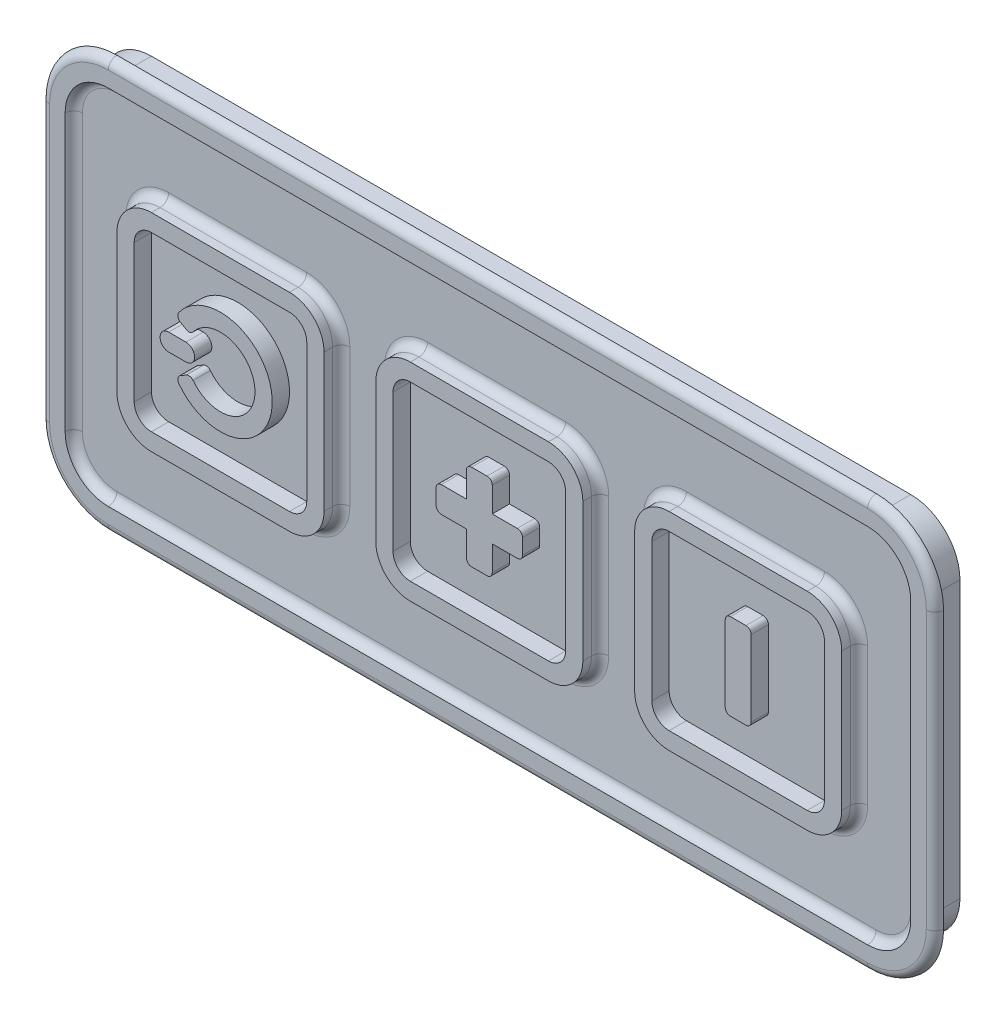
from build123d import *

# Parameters (mm, degrees)
EXTRUDE_1_DEPTH     = 2
EXTRUDE_2_DEPTH     = 0.5
CUT_EXTRUDE_1_DEPTH = 1
EXTRUDE_3_DEPTH     = 1
FILLET_3_R          = 0.5
EXTRUDE_4_DEPTH     = 1
CUT_EXTRUDE_2_DEPTH = 2
FILLET_5_R          = 0.5
EXTRUDE_START       = 1
EXTRUDE_5_DEPTH     = 1
FILLET_6_R          = 0.5


with BuildPart() as part:
    # 草图1 → 凸台-拉伸1 (new body)
    with BuildSketch(Plane.XY):
        with BuildLine():
            Line((26.455957239, 8), (26.455957239, -8))
            ThreePointArc((26.455957239, -8), (27.305347574, -10.050609665), (29.355957239, -10.9))
            Line((29.355957239, -10.9), (73.355957239, -10.9))
            ThreePointArc((73.355957239, -10.9), (75.406566904, -10.050609665), (76.255957239, -8))
            Line((76.255957239, -8), (76.255957239, 8))
            ThreePointArc((76.255957239, 8), (75.406566904, 10.050609665), (73.355957239, 10.9))
            Line((73.355957239, 10.9), (29.355957239, 10.9))
            ThreePointArc((29.355957239, 10.9), (27.305347574, 10.050609665), (26.455957239, 8))
        make_face()
    extrude(amount=-EXTRUDE_1_DEPTH)

    # 草图2 → 凸台-拉伸2 (add)
    with BuildSketch(Plane.XY):
        with BuildLine():
            Line((25.455957239, 8), (25.455957239, -8))
            ThreePointArc((25.455957239, -8), (26.598240792, -10.757716447), (29.355957239, -11.9))
            Line((29.355957239, -11.9), (73.355957239, -11.9))
            ThreePointArc((73.355957239, -11.9), (76.113673686, -10.757716447), (77.255957239, -8))
            Line((77.255957239, -8), (77.255957239, 8))
            ThreePointArc((77.255957239, 8), (76.113673686, 10.757716447), (73.355957239, 11.9))
            Line((73.355957239, 11.9), (29.355957239, 11.9))
            ThreePointArc((29.355957239, 11.9), (26.598240792, 10.757716447), (25.455957239, 8))
        make_face()
        with BuildLine():
            Line((26.855957239, 8), (26.855957239, -8))
            ThreePointArc((26.855957239, -8), (27.588190286, -9.767766953), (29.355957239, -10.5))
            Line((29.355957239, -10.5), (73.355957239, -10.5))
            ThreePointArc((73.355957239, -10.5), (75.123724192, -9.767766953), (75.855957239, -8))
            Line((75.855957239, -8), (75.855957239, 8))
            ThreePointArc((75.855957239, 8), (75.123724192, 9.767766953), (73.355957239, 10.5))
            Line((73.355957239, 10.5), (29.355957239, 10.5))
            ThreePointArc((29.355957239, 10.5), (27.588190286, 9.767766953), (26.855957239, 8))
        make_face(mode=Mode.SUBTRACT)
    extrude(amount=EXTRUDE_2_DEPTH)

    # 草图3 → 切除-拉伸1 (cut)
    with BuildSketch(Plane(origin=(0, 0, -2), x_dir=(-1, 0, 0), z_dir=(0, 0, -1))):
        with BuildLine():
            Line((-29.355957239, 9.9), (-73.355957239, 9.9))
            ThreePointArc((-73.355957239, 9.9), (-74.699460123, 9.343502884), (-75.255957239, 8))
            Line((-75.255957239, 8), (-75.255957239, -8))
            ThreePointArc((-75.255957239, -8), (-74.699460123, -9.343502884), (-73.355957239, -9.9))
            Line((-73.355957239, -9.9), (-29.355957239, -9.9))
            ThreePointArc((-29.355957239, -9.9), (-28.012454355, -9.343502884), (-27.455957239, -8))
            Line((-27.455957239, -8), (-27.455957239, 8))
            ThreePointArc((-27.455957239, 8), (-28.012454355, 9.343502884), (-29.355957239, 9.9))
        make_face()
    extrude(amount=-CUT_EXTRUDE_1_DEPTH, mode=Mode.SUBTRACT)

    # 草图4 → 凸台-拉伸3 (add)
    # profile 1 of 3: a face of its own
    with BuildSketch(Plane.XY):
        with BuildLine():
            Line((32.355957239, 6), (40.355957239, 6))
            ThreePointArc((40.355957239, 6), (41.770170801, 5.414213562), (42.355957239, 4))
            Line((42.355957239, 4), (42.355957239, -4))
            ThreePointArc((42.355957239, -4), (41.770170801, -5.414213562), (40.355957239, -6))
            Line((40.355957239, -6), (32.355957239, -6))
            ThreePointArc((32.355957239, -6), (30.941743677, -5.414213562), (30.355957239, -4))
            Line((30.355957239, -4), (30.355957239, 4))
            ThreePointArc((30.355957239, 4), (30.941743677, 5.414213562), (32.355957239, 6))
        make_face()
        with BuildLine():
            Line((32.355957239, 5), (40.355957239, 5))
            ThreePointArc((40.355957239, 5), (41.06306402, 4.707106781), (41.355957239, 4))
            Line((41.355957239, 4), (41.355957239, -4))
            ThreePointArc((41.355957239, -4), (41.06306402, -4.707106781), (40.355957239, -5))
            Line((40.355957239, -5), (32.355957239, -5))
            ThreePointArc((32.355957239, -5), (31.648850458, -4.707106781), (31.355957239, -4))
            Line((31.355957239, -4), (31.355957239, 4))
            ThreePointArc((31.355957239, 4), (31.648850458, 4.707106781), (32.355957239, 5))
        make_face(mode=Mode.SUBTRACT)
    # profile 2 of 3: a face of its own
    with BuildSketch(Plane.XY):
        with BuildLine():
            Line((47.355957239, 6), (55.355957239, 6))
            ThreePointArc((55.355957239, 6), (56.770170801, 5.414213562), (57.355957239, 4))
            Line((57.355957239, 4), (57.355957239, -4))
            ThreePointArc((57.355957239, -4), (56.770170801, -5.414213562), (55.355957239, -6))
            Line((55.355957239, -6), (47.355957239, -6))
            ThreePointArc((47.355957239, -6), (45.941743677, -5.414213562), (45.355957239, -4))
            Line((45.355957239, -4), (45.355957239, 4))
            ThreePointArc((45.355957239, 4), (45.941743677, 5.414213562), (47.355957239, 6))
        make_face()
        with BuildLine():
            Line((47.355957239, 5), (55.355957239, 5))
            ThreePointArc((55.355957239, 5), (56.06306402, 4.707106781), (56.355957239, 4))
            Line((56.355957239, 4), (56.355957239, -4))
            ThreePointArc((56.355957239, -4), (56.06306402, -4.707106781), (55.355957239, -5))
            Line((55.355957239, -5), (47.355957239, -5))
            ThreePointArc((47.355957239, -5), (46.648850458, -4.707106781), (46.355957239, -4))
            Line((46.355957239, -4), (46.355957239, 4))
            ThreePointArc((46.355957239, 4), (46.648850458, 4.707106781), (47.355957239, 5))
        make_face(mode=Mode.SUBTRACT)
    # profile 3 of 3: a face of its own
    with BuildSketch(Plane.XY):
        with BuildLine():
            Line((62.355957239, 6), (70.355957239, 6))
            ThreePointArc((70.355957239, 6), (71.770170801, 5.414213562), (72.355957239, 4))
            Line((72.355957239, 4), (72.355957239, -4))
            ThreePointArc((72.355957239, -4), (71.770170801, -5.414213562), (70.355957239, -6))
            Line((70.355957239, -6), (62.355957239, -6))
            ThreePointArc((62.355957239, -6), (60.941743677, -5.414213562), (60.355957239, -4))
            Line((60.355957239, -4), (60.355957239, 4))
            ThreePointArc((60.355957239, 4), (60.941743677, 5.414213562), (62.355957239, 6))
        make_face()
        with BuildLine():
            Line((62.355957239, 5), (70.355957239, 5))
            ThreePointArc((70.355957239, 5), (71.06306402, 4.707106781), (71.355957239, 4))
            Line((71.355957239, 4), (71.355957239, -4))
            ThreePointArc((71.355957239, -4), (71.06306402, -4.707106781), (70.355957239, -5))
            Line((70.355957239, -5), (62.355957239, -5))
            ThreePointArc((62.355957239, -5), (61.648850458, -4.707106781), (61.355957239, -4))
            Line((61.355957239, -4), (61.355957239, 4))
            ThreePointArc((61.355957239, 4), (61.648850458, 4.707106781), (62.355957239, 5))
        make_face(mode=Mode.SUBTRACT)
    extrude(amount=EXTRUDE_3_DEPTH)

    # 圆角3
    fillet_3_edges = [part.edges().sort_by_distance(p)[0] for p in [
        (60.941743677, -5.414213562, 0),
        (66.355957239, -6, 0),
        (71.770170801, -5.414213562, 0),
        (72.355957239, 0, 0),
        (71.770170801, 5.414213562, 0),
        (66.355957239, 6, 0),
        (60.941743677, 5.414213562, 0),
        (60.355957239, 0, 0),
        (30.941743677, -5.414213562, 0),
        (36.355957239, -6, 0),
        (41.770170801, -5.414213562, 0),
        (42.355957239, 0, 0),
        (41.770170801, 5.414213562, 0),
        (36.355957239, 6, 0),
        (30.941743677, 5.414213562, 0),
        (30.355957239, 0, 0),
        (45.941743677, -5.414213562, 0),
        (51.355957239, -6, 0),
        (56.770170801, -5.414213562, 0),
        (57.355957239, 0, 0),
        (56.770170801, 5.414213562, 0),
        (51.355957239, 6, 0),
        (45.941743677, 5.414213562, 0),
        (45.355957239, 0, 0),
        (51.355957239, 10.5, 0),
        (75.123724192, 9.767766953, 0),
        (75.855957239, 0, 0),
        (75.123724192, -9.767766953, 0),
        (51.355957239, -10.5, 0),
        (27.588190286, -9.767766953, 0),
        (26.855957239, 0, 0),
        (27.588190286, 9.767766953, 0),
    ]]
    fillet(fillet_3_edges, radius=FILLET_3_R - 0.0001)  # a hair under: the kernel refuses the full size

    # 草图5 → 凸台-拉伸4 (add)
    with BuildSketch(Plane.XY):
        with BuildLine():
            Line((65.905957239, -2.5), (66.805957239, -2.5))
            ThreePointArc((66.805957239, -2.5), (67.018089273, -2.412132034), (67.105957239, -2.2))
            Line((67.105957239, -2.2), (67.105957239, 2.2))
            ThreePointArc((67.105957239, 2.2), (67.018089273, 2.412132034), (66.805957239, 2.5))
            Line((66.805957239, 2.5), (65.905957239, 2.5))
            ThreePointArc((65.905957239, 2.5), (65.693825205, 2.412132034), (65.605957239, 2.2))
            Line((65.605957239, 2.2), (65.605957239, -2.2))
            ThreePointArc((65.605957239, -2.2), (65.693825205, -2.412132034), (65.905957239, -2.5))
        make_face()
        with BuildLine():
            Line((50.905957239, -2.5), (51.805957239, -2.5))
            ThreePointArc((51.805957239, -2.5), (52.018089273, -2.412132034), (52.105957239, -2.2))
            Line((52.105957239, -2.2), (52.105957239, -0.75))
            Line((52.105957239, -0.75), (53.555957239, -0.75))
            ThreePointArc((53.555957239, -0.75), (53.768089273, -0.662132034), (53.855957239, -0.45))
            Line((53.855957239, -0.45), (53.855957239, 0.45))
            ThreePointArc((53.855957239, 0.45), (53.768089273, 0.662132034), (53.555957239, 0.75))
            Line((53.555957239, 0.75), (52.105957239, 0.75))
            Line((52.105957239, 0.75), (52.105957239, 2.2))
            ThreePointArc((52.105957239, 2.2), (52.018089273, 2.412132034), (51.805957239, 2.5))
            Line((51.805957239, 2.5), (50.905957239, 2.5))
            ThreePointArc((50.905957239, 2.5), (50.693825205, 2.412132034), (50.605957239, 2.2))
            Line((50.605957239, 2.2), (50.605957239, 0.75))
            Line((50.605957239, 0.75), (49.155957239, 0.75))
            ThreePointArc((49.155957239, 0.75), (48.943825205, 0.662132034), (48.855957239, 0.45))
            Line((48.855957239, 0.45), (48.855957239, -0.45))
            ThreePointArc((48.855957239, -0.45), (48.943825205, -0.662132034), (49.155957239, -0.75))
            Line((49.155957239, -0.75), (50.605957239, -0.75))
            Line((50.605957239, -0.75), (50.605957239, -2.2))
            ThreePointArc((50.605957239, -2.2), (50.693825205, -2.412132034), (50.905957239, -2.5))
        make_face()
        with BuildLine():
            Line((33.355957239, 0.5), (34.355957239, 0.5))
            ThreePointArc((34.355957239, 0.5), (34.855957239, 0), (34.355957239, -0.5))
            Line((34.355957239, -0.5), (33.355957239, -0.5))
            ThreePointArc((33.355957239, -0.5), (32.855957239, 0), (33.355957239, 0.5))
        make_face()
        with BuildLine():
            Line((34.381115473, -1.140175425), (34.032167231, -1.341640786))
            ThreePointArc((34.032167231, -1.341640786), (33.888518064, -1.540046726), (33.940635008, -1.77938712))
            ThreePointArc((33.940635008, -1.77938712), (39.355957239, 0), (33.940635008, 1.77938712))
            ThreePointArc((33.940635008, 1.77938712), (33.888518064, 1.540046726), (34.032167231, 1.341640786))
            Line((34.032167231, 1.341640786), (34.381115473, 1.140175425))
            ThreePointArc((34.381115473, 1.140175425), (34.589656134, 1.10575016), (34.769138312, 1.217376562))
            ThreePointArc((34.769138312, 1.217376562), (38.355957239, 0), (34.769138312, -1.217376562))
            ThreePointArc((34.769138312, -1.217376562), (34.589656134, -1.10575016), (34.381115473, -1.140175425))
        make_face()
    extrude(amount=EXTRUDE_4_DEPTH)

    # 草图6 → 切除-拉伸2 (cut)
    with BuildSketch(Plane(origin=(0, 0, -2), x_dir=(-1, 0, 0), z_dir=(0, 0, -1))):
        with BuildLine():
            Line((-29.355957239, 12.85), (-73.355957239, 12.85))
            ThreePointArc((-73.355957239, 12.85), (-76.785425128, 11.429467889), (-78.205957239, 8))
            Line((-78.205957239, 8), (-78.205957239, -8))
            ThreePointArc((-78.205957239, -8), (-76.785425128, -11.429467889), (-73.355957239, -12.85))
            Line((-73.355957239, -12.85), (-29.355957239, -12.85))
            ThreePointArc((-29.355957239, -12.85), (-25.92648935, -11.429467889), (-24.505957239, -8))
            Line((-24.505957239, -8), (-24.505957239, 8))
            ThreePointArc((-24.505957239, 8), (-25.92648935, 11.429467889), (-29.355957239, 12.85))
        make_face()
        with BuildLine():
            Line((-29.355957239, 10.85), (-73.355957239, 10.85))
            ThreePointArc((-73.355957239, 10.85), (-75.371211565, 10.015254326), (-76.205957239, 8))
            Line((-76.205957239, 8), (-76.205957239, -8))
            ThreePointArc((-76.205957239, -8), (-75.371211565, -10.015254326), (-73.355957239, -10.85))
            Line((-73.355957239, -10.85), (-29.355957239, -10.85))
            ThreePointArc((-29.355957239, -10.85), (-27.340702913, -10.015254326), (-26.505957239, -8))
            Line((-26.505957239, -8), (-26.505957239, 8))
            ThreePointArc((-26.505957239, 8), (-27.340702913, 10.015254326), (-29.355957239, 10.85))
        make_face(mode=Mode.SUBTRACT)
    extrude(amount=-CUT_EXTRUDE_2_DEPTH, mode=Mode.SUBTRACT)

    # 圆角5
    fillet_5_edges = [part.edges().sort_by_distance(p)[0] for p in [
        (26.598240792, -10.757716447, 0.5),
        (25.455957239, 0, 0.5),
        (26.598240792, 10.757716447, 0.5),
        (51.355957239, 11.9, 0.5),
        (76.113673686, 10.757716447, 0.5),
        (77.255957239, 0, 0.5),
        (76.113673686, -10.757716447, 0.5),
        (51.355957239, -11.9, 0.5),
    ]]
    fillet(fillet_5_edges, radius=FILLET_5_R - 0.0001)  # a hair under: the kernel refuses the full size

    # 草图7 → 凸台-拉伸5 (add)
    # profile 1 of 3: a face of its own
    with BuildSketch(Plane(origin=(0, 0, -1), x_dir=(-1, 0, 0), z_dir=(0, 0, -1)).offset(EXTRUDE_START)):
        with BuildLine():
            Line((-70.514176183, 6.079109472), (-62.514176183, 6.079109472))
            ThreePointArc((-62.514176183, 6.079109472), (-61.099962621, 5.493323035), (-60.514176183, 4.079109472))
            Line((-60.514176183, 4.079109472), (-60.514176183, -3.920890528))
            ThreePointArc((-60.514176183, -3.920890528), (-61.099962621, -5.33510409), (-62.514176183, -5.920890528))
            Line((-62.514176183, -5.920890528), (-70.514176183, -5.920890528))
            ThreePointArc((-70.514176183, -5.920890528), (-71.928389746, -5.33510409), (-72.514176183, -3.920890528))
            Line((-72.514176183, -3.920890528), (-72.514176183, 4.079109472))
            ThreePointArc((-72.514176183, 4.079109472), (-71.928389746, 5.493323035), (-70.514176183, 6.079109472))
        make_face()
        with BuildLine():
            Line((-70.514176183, 5), (-62.514176183, 5))
            ThreePointArc((-62.514176183, 5), (-61.807069402, 4.707106781), (-61.514176183, 4))
            Line((-61.514176183, 4), (-61.514176183, -4))
            ThreePointArc((-61.514176183, -4), (-61.807069402, -4.707106781), (-62.514176183, -5))
            Line((-62.514176183, -5), (-70.514176183, -5))
            ThreePointArc((-70.514176183, -5), (-71.221282965, -4.707106781), (-71.514176183, -4))
            Line((-71.514176183, -4), (-71.514176183, 4))
            ThreePointArc((-71.514176183, 4), (-71.221282965, 4.707106781), (-70.514176183, 5))
        make_face(mode=Mode.SUBTRACT)
    # profile 2 of 3: a face of its own
    with BuildSketch(Plane(origin=(0, 0, -1), x_dir=(-1, 0, 0), z_dir=(0, 0, -1)).offset(EXTRUDE_START)):
        with BuildLine():
            Line((-55.514176183, 6.079109472), (-47.514176183, 6.079109472))
            ThreePointArc((-47.514176183, 6.079109472), (-46.099962621, 5.493323035), (-45.514176183, 4.079109472))
            Line((-45.514176183, 4.079109472), (-45.514176183, -3.920890528))
            ThreePointArc((-45.514176183, -3.920890528), (-46.099962621, -5.33510409), (-47.514176183, -5.920890528))
            Line((-47.514176183, -5.920890528), (-55.514176183, -5.920890528))
            ThreePointArc((-55.514176183, -5.920890528), (-56.928389746, -5.33510409), (-57.514176183, -3.920890528))
            Line((-57.514176183, -3.920890528), (-57.514176183, 4.079109472))
            ThreePointArc((-57.514176183, 4.079109472), (-56.928389746, 5.493323035), (-55.514176183, 6.079109472))
        make_face()
        with BuildLine():
            Line((-55.355957239, 5), (-47.355957239, 5))
            ThreePointArc((-47.355957239, 5), (-46.648850458, 4.707106781), (-46.355957239, 4))
            Line((-46.355957239, 4), (-46.355957239, -4))
            ThreePointArc((-46.355957239, -4), (-46.648850458, -4.707106781), (-47.355957239, -5))
            Line((-47.355957239, -5), (-55.355957239, -5))
            ThreePointArc((-55.355957239, -5), (-56.06306402, -4.707106781), (-56.355957239, -4))
            Line((-56.355957239, -4), (-56.355957239, 4))
            ThreePointArc((-56.355957239, 4), (-56.06306402, 4.707106781), (-55.355957239, 5))
        make_face(mode=Mode.SUBTRACT)
    # profile 3 of 3: a face of its own
    with BuildSketch(Plane(origin=(0, 0, -1), x_dir=(-1, 0, 0), z_dir=(0, 0, -1)).offset(EXTRUDE_START)):
        with BuildLine():
            Line((-40.514176183, 6.079109472), (-32.514176183, 6.079109472))
            ThreePointArc((-32.514176183, 6.079109472), (-31.099962621, 5.493323035), (-30.514176183, 4.079109472))
            Line((-30.514176183, 4.079109472), (-30.514176183, -3.920890528))
            ThreePointArc((-30.514176183, -3.920890528), (-31.099962621, -5.33510409), (-32.514176183, -5.920890528))
            Line((-32.514176183, -5.920890528), (-40.514176183, -5.920890528))
            ThreePointArc((-40.514176183, -5.920890528), (-41.928389746, -5.33510409), (-42.514176183, -3.920890528))
            Line((-42.514176183, -3.920890528), (-42.514176183, 4.079109472))
            ThreePointArc((-42.514176183, 4.079109472), (-41.928389746, 5.493323035), (-40.514176183, 6.079109472))
        make_face()
        with BuildLine():
            Line((-40.514176183, 5), (-32.514176183, 5))
            ThreePointArc((-32.514176183, 5), (-31.807069402, 4.707106781), (-31.514176183, 4))
            Line((-31.514176183, 4), (-31.514176183, -4))
            ThreePointArc((-31.514176183, -4), (-31.807069402, -4.707106781), (-32.514176183, -5))
            Line((-32.514176183, -5), (-40.514176183, -5))
            ThreePointArc((-40.514176183, -5), (-41.221282965, -4.707106781), (-41.514176183, -4))
            Line((-41.514176183, -4), (-41.514176183, 4))
            ThreePointArc((-41.514176183, 4), (-41.221282965, 4.707106781), (-40.514176183, 5))
        make_face(mode=Mode.SUBTRACT)
    extrude(amount=-EXTRUDE_5_DEPTH)

    # 圆角6
    fillet_6_edges = [part.edges().sort_by_distance(p)[0] for p in [
        (61.807069402, 4.707106781, -1),
        (66.514176183, 5, -1),
        (71.221282965, 4.707106781, -1),
        (71.514176183, 0, -1),
        (71.221282965, -4.707106781, -1),
        (66.514176183, -5, -1),
        (61.807069402, -4.707106781, -1),
        (61.514176183, 0, -1),
        (71.928389746, 5.493323035, -1),
        (72.514176183, 0.079109472, -1),
        (71.928389746, -5.33510409, -1),
        (66.514176183, -5.920890528, -1),
        (61.099962621, -5.33510409, -1),
        (60.514176183, 0.079109472, -1),
        (61.099962621, 5.493323035, -1),
        (66.514176183, 6.079109472, -1),
        (46.648850458, 4.707106781, -1),
        (51.355957239, 5, -1),
        (56.06306402, 4.707106781, -1),
        (56.355957239, 0, -1),
        (56.06306402, -4.707106781, -1),
        (51.355957239, -5, -1),
        (46.648850458, -4.707106781, -1),
        (46.355957239, 0, -1),
        (56.928389746, 5.493323035, -1),
        (57.514176183, 0.079109472, -1),
        (56.928389746, -5.33510409, -1),
        (51.514176183, -5.920890528, -1),
        (46.099962621, -5.33510409, -1),
        (45.514176183, 0.079109472, -1),
        (46.099962621, 5.493323035, -1),
        (51.514176183, 6.079109472, -1),
        (31.807069402, 4.707106781, -1),
        (36.514176183, 5, -1),
        (41.221282965, 4.707106781, -1),
        (41.514176183, 0, -1),
        (41.221282965, -4.707106781, -1),
        (36.514176183, -5, -1),
        (31.807069402, -4.707106781, -1),
        (31.514176183, 0, -1),
        (41.928389746, 5.493323035, -1),
        (42.514176183, 0.079109472, -1),
        (41.928389746, -5.33510409, -1),
        (36.514176183, -5.920890528, -1),
        (31.099962621, -5.33510409, -1),
        (30.514176183, 0.079109472, -1),
        (31.099962621, 5.493323035, -1),
        (36.514176183, 6.079109472, -1),
        (28.012454355, 9.343502884, -1),
        (27.455957239, 0, -1),
        (28.012454355, -9.343502884, -1),
        (51.355957239, -9.9, -1),
        (74.699460123, -9.343502884, -1),
        (75.255957239, 0, -1),
        (74.699460123, 9.343502884, -1),
        (51.355957239, 9.9, -1),
    ]]
    fillet(fillet_6_edges, radius=FILLET_6_R)


solid = part.part
